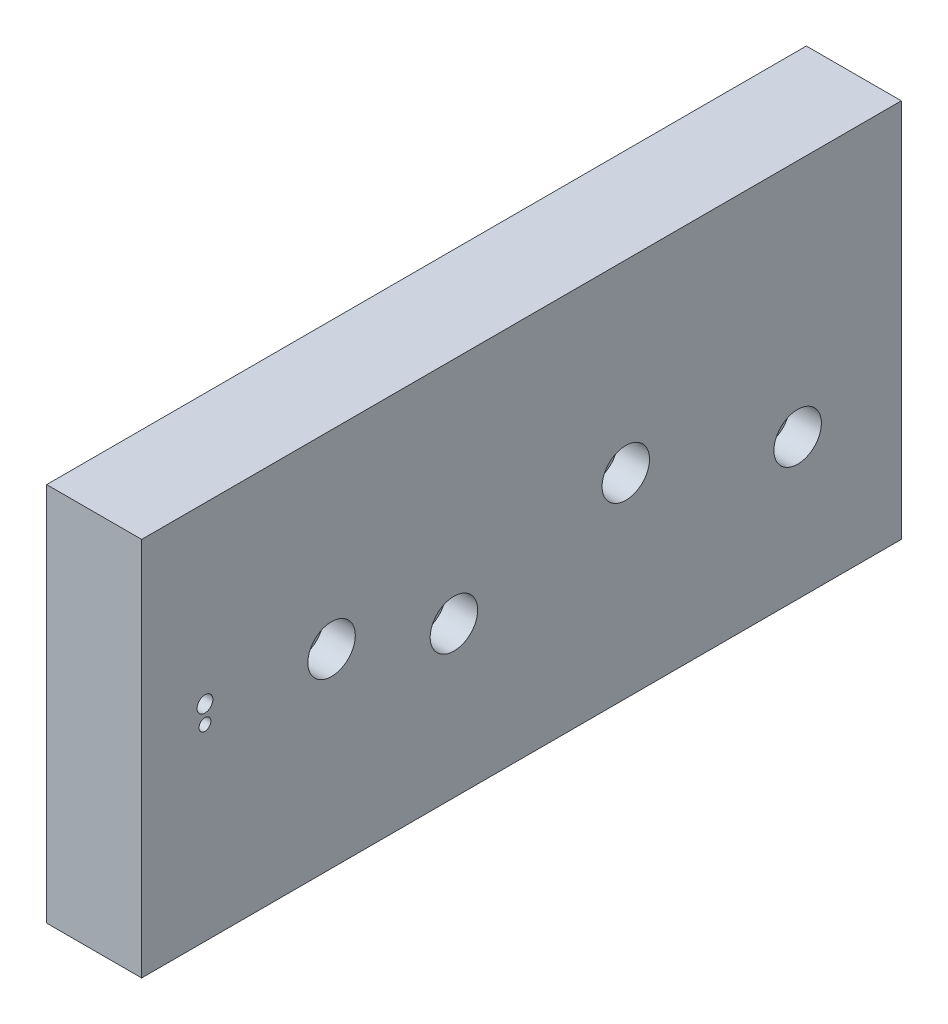
from build123d import *

# Parameters (mm, degrees)
SKETCH1_W                       = 152.4
SKETCH1_H                       = 76.2
SKETCH1_R                       = 1.5875
SKETCH1_R_2                     = 1.190625
BOSS_EXTRUDE1_DEPTH             = 19.05
SKETCH3_R                       = 4.7625
CUT_EXTRUDE2_DEPTH              = 6.35
F_1_4_0_25_DIAMETER_HOLE1_D     = 6.35
F_1_4_0_25_DIAMETER_HOLE1_DEPTH = 12.7
F_1_4_0_25_DIAMETER_HOLE1_TIP   = 1.907732465


with BuildPart() as part:
    # Sketch1 → Boss-Extrude1 (new body)
    with BuildSketch(Plane(origin=(0, 0, 0), x_dir=(0, 0, -1), z_dir=(1, 0, 0))):
        Rectangle(SKETCH1_W, SKETCH1_H)
        with Locations((20.927, 1.096077564)):
            Circle(SKETCH1_R, mode=Mode.SUBTRACT)
        with Locations((-38.1, 0)):
            Circle(SKETCH1_R, mode=Mode.SUBTRACT)
        with Locations((-63.5, 3.175)):
            Circle(SKETCH1_R, mode=Mode.SUBTRACT)
        with Locations((55.404, -9.873506796)):
            Circle(SKETCH1_R, mode=Mode.SUBTRACT)
        with Locations((-13.55, -7.860160556)):
            Circle(SKETCH1_R, mode=Mode.SUBTRACT)
        with Locations((-63.5, -0.396875)):
            Circle(SKETCH1_R_2, mode=Mode.SUBTRACT)
    extrude(amount=BOSS_EXTRUDE1_DEPTH)

    # Sketch3 → Cut-Extrude2 (cut)
    with BuildSketch(Plane(origin=(19.05, 0, 0), x_dir=(0, 0, -1), z_dir=(1, 0, 0))):
        with Locations((-38.1, 0)):
            Circle(SKETCH3_R)
        with Locations((-13.55, -7.860160556)):
            Circle(SKETCH3_R)
        with Locations((20.927, 1.096077564)):
            Circle(SKETCH3_R)
        with Locations((55.404, -9.873506796)):
            Circle(SKETCH3_R)
    extrude(amount=-CUT_EXTRUDE2_DEPTH, mode=Mode.SUBTRACT)

    # 1/4 (0.25) Diameter Hole1
    with Locations(Plane.XZ.offset(38.1)):
        with Locations((9.525, 57.15), (9.525, 0), (9.525, -63.5)):
            Hole(F_1_4_0_25_DIAMETER_HOLE1_D / 2, depth=F_1_4_0_25_DIAMETER_HOLE1_DEPTH)
            with Locations((0, 0, -(F_1_4_0_25_DIAMETER_HOLE1_DEPTH + F_1_4_0_25_DIAMETER_HOLE1_TIP / 2))):  # 118° drill point
                Cone(0, F_1_4_0_25_DIAMETER_HOLE1_D / 2, F_1_4_0_25_DIAMETER_HOLE1_TIP, mode=Mode.SUBTRACT)


solid = part.part
